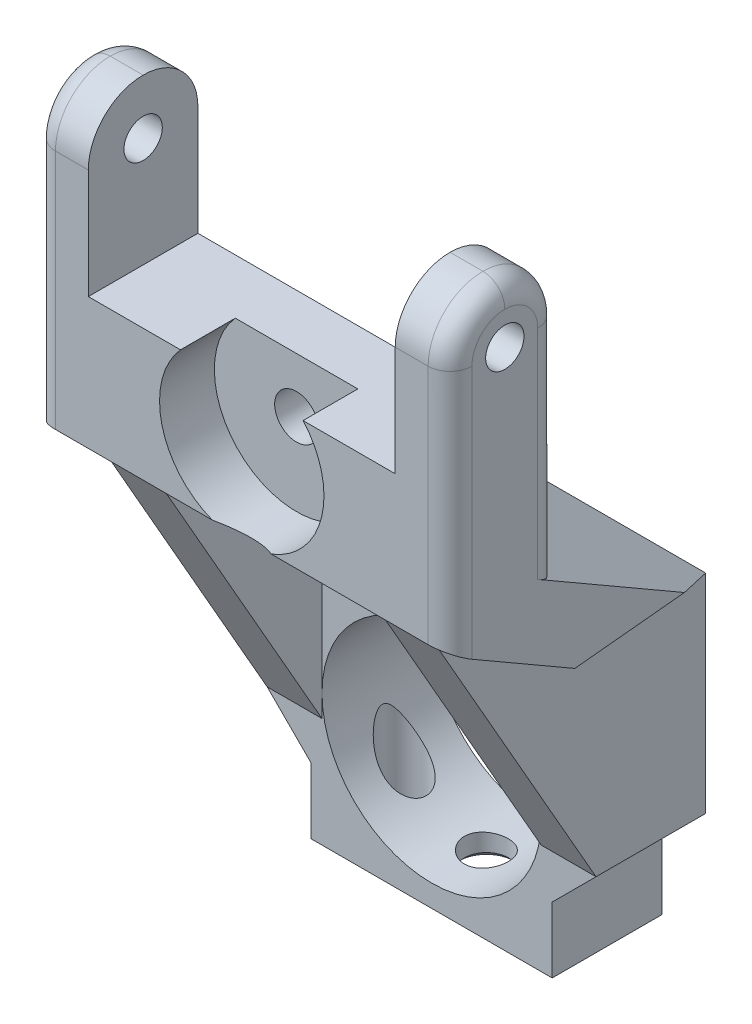
from build123d import *

# Parameters (mm, degrees)
SKETCH1_W           = 30
SKETCH1_H           = 29
BOSS_EXTRUDE1_DEPTH = 10
SKETCH2_W           = 4
SKETCH2_H           = 10
CUT_EXTRUDE1_DEPTH  = 10
CHAMFER1_SIZE       = 4
SKETCH3_R           = 2
CUT_EXTRUDE2_DEPTH  = 15
CHAMFER2_SIZE       = 0.5
SKETCH4_R           = 10
CUT_EXTRUDE3_DEPTH  = 24.135470603
BOSS_EXTRUDE2_DEPTH = 19
CHAMFER3_SIZE       = 4
SKETCH6_W           = 28
SKETCH6_H           = 10
CUT_EXTRUDE4_DEPTH  = 15
FILLET1_R           = 5
SKETCH7_R           = 1.75
CUT_EXTRUDE5_DEPTH  = 69.85245211
FILLET2_R           = 2
SKETCH8_R           = 2
CUT_EXTRUDE6_DEPTH  = 61.478592634
SKETCH9_R           = 7.5
CUT_EXTRUDE7_DEPTH  = 5
BOSS_EXTRUDE3_DEPTH = 5


with BuildPart() as part:
    # Sketch1 → Boss-Extrude1 (new body)
    with BuildSketch(Plane.XY):
        Rectangle(SKETCH1_W, SKETCH1_H)
    extrude(amount=BOSS_EXTRUDE1_DEPTH)

    # Sketch2 → Cut-Extrude1 (cut)
    with BuildSketch(Plane.XZ.offset(14.5)):
        with Locations((-13, 5)):
            Rectangle(SKETCH2_W, SKETCH2_H)
        with Locations((13, 5)):
            Rectangle(SKETCH2_W, SKETCH2_H)
    extrude(amount=-CUT_EXTRUDE1_DEPTH, mode=Mode.SUBTRACT)

    # Chamfer1
    chamfer1_edges = [part.edges().sort_by_distance(p)[0] for p in [
        (11, -4.5, 5),
        (-11, -4.5, 5),
    ]]
    chamfer(chamfer1_edges, length=CHAMFER1_SIZE - 0.0001)  # a hair under: the kernel refuses the full size

    # Sketch3 → Cut-Extrude2 (cut)
    with BuildSketch(Plane.XZ.offset(14.5)):
        with Locations(Location((-7.5, 5, 0), (0, 0, 270))):
            Circle(SKETCH3_R)
        with Locations(Location((0, 5, 0), (0, 0, 270))):
            Circle(SKETCH3_R)
        with Locations(Location((7.5, 5, 0), (0, 0, 270))):
            Circle(SKETCH3_R)
    extrude(amount=-CUT_EXTRUDE2_DEPTH, mode=Mode.SUBTRACT)

    # Chamfer2
    chamfer2_edges = [part.edges().sort_by_distance(p)[0] for p in [
        (-7.5, -14.5, 7),
        (0, -14.5, 7),
        (7.5, -14.5, 7),
    ]]
    chamfer(chamfer2_edges, length=CHAMFER2_SIZE)

    # Sketch4 → Cut-Extrude3 (cut, through all)
    with BuildSketch(Plane(origin=(0, 0, 0), x_dir=(-1, 0, 0), z_dir=(0, 0, -1))):
        with Locations((0, -2.5)):
            Circle(SKETCH4_R)
    extrude(amount=-CUT_EXTRUDE3_DEPTH, mode=Mode.SUBTRACT)

    # Sketch5 → Boss-Extrude2 (add, symmetric)
    with BuildSketch(Plane(origin=(0, 0, 0), x_dir=(0, 0, -1), z_dir=(1, 0, 0))):
        Polygon((-10, 13.5), (-27.320508076, 23.5), (-27.320508076, 50.5), (-17.320508076, 50.5), (-17.320508076, 24.5), (0, 14.5), align=None)
    extrude(amount=BOSS_EXTRUDE2_DEPTH, both=True)

    # Chamfer3
    chamfer3_edges = [part.edges().sort_by_distance(p)[0] for p in [
        (-19, 14, 5),
        (19, 14, 5),
    ]]
    chamfer(chamfer3_edges, length=CHAMFER3_SIZE - 0.0001)  # a hair under: the kernel refuses the full size

    # Sketch6 → Cut-Extrude4 (cut)
    with BuildSketch(Plane(origin=(0, 50.5, 0), x_dir=(1, 0, 0), z_dir=(0, 1, 0))):
        with Locations((0, -22.320508076)):
            Rectangle(SKETCH6_W, SKETCH6_H)
    extrude(amount=-CUT_EXTRUDE4_DEPTH, mode=Mode.SUBTRACT)

    # Fillet1
    fillet1_edges = [part.edges().sort_by_distance(p)[0] for p in [
        (16.5, 50.5, 17.320508076),
        (16.5, 50.5, 27.320508076),
        (-16.5, 50.5, 17.320508076),
        (-16.5, 50.5, 27.320508076),
    ]]
    fillet(fillet1_edges, radius=FILLET1_R - 0.0001)  # a hair under: the kernel refuses the full size

    # Sketch7 → Cut-Extrude5 (cut, through all)
    with BuildSketch(Plane(origin=(19, 0, 0), x_dir=(0, 0, -1), z_dir=(1, 0, 0))):
        with Locations((-22.320508076, 45.5)):
            Circle(SKETCH7_R)
    extrude(amount=-CUT_EXTRUDE5_DEPTH, mode=Mode.SUBTRACT)

    # Fillet2
    fillet2_edges = [part.edges().sort_by_distance(p)[0] for p in [
        (19, 34.50005, 27.320508076),
        (19, 49.035563195, 25.856071271),
        (19, 49.035563195, 18.78494488),
        (-19, 34.50005, 27.320508076),
        (-19, 49.035563195, 25.856071271),
        (-19, 49.035563195, 18.78494488),
        (-19, 35.00005, 17.320508076),
        (19, 35.00005, 17.320508076),
    ]]
    fillet(fillet2_edges, radius=FILLET2_R)

    # Sketch8 → Cut-Extrude6 (cut, through all)
    with BuildSketch(Plane.XY.offset(27.320508076)):
        with Locations((0, 30.5)):
            Circle(SKETCH8_R)
    extrude(amount=-CUT_EXTRUDE6_DEPTH, mode=Mode.SUBTRACT)

    # Sketch9 → Cut-Extrude7 (cut)
    with BuildSketch(Plane.XY.offset(27.320508076)):
        with Locations((0, 30.5)):
            Circle(SKETCH9_R)
    extrude(amount=-CUT_EXTRUDE7_DEPTH, mode=Mode.SUBTRACT)

    # Sketch10 → Boss-Extrude3 (add)
    with BuildSketch(Plane(origin=(15, 0, 0), x_dir=(0, 0, -1), z_dir=(1, 0, 0))):
        Polygon((-10, -4.5), (-25.320508076, 22.345299462), (-10, 13.5), align=None)
    boss_extrude3 = extrude(amount=-BOSS_EXTRUDE3_DEPTH)

    # Mirror1: Boss-Extrude3 across plane
    add(boss_extrude3.mirror(Plane(origin=(0, 0, 0), x_dir=(0, 0, 1), z_dir=(1, 0, 0))))


solid = part.part
